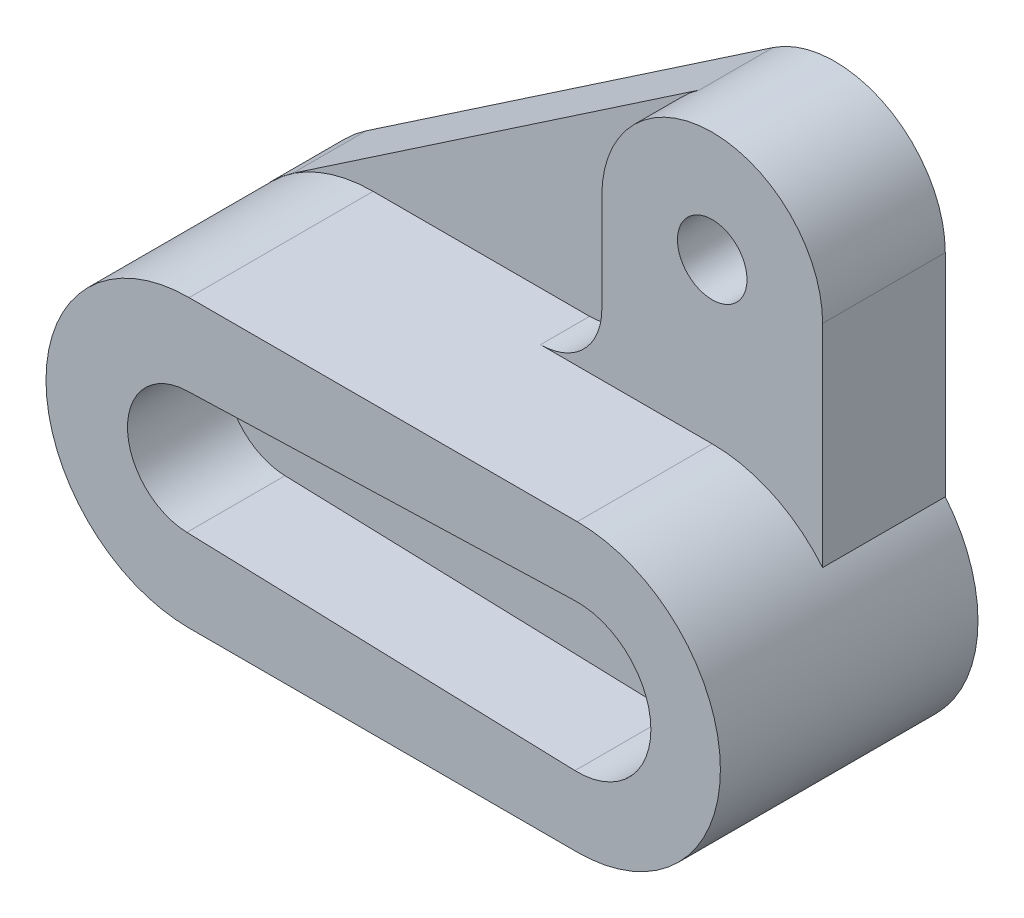
from build123d import *

# Parameters (mm, degrees)
SKETCH1_R           = 8.5
BASE_DEPTH          = 18
BACK_CUT_DEPTH      = 15
BOSS_EXTRUDE2_DEPTH = 45
SKETCH5_R           = 8.5
BOSS_EXTRUDE4_DEPTH = 12
FILLET1_R           = 15
CUT_EXTRUDE2_START  = -24
CUT_EXTRUDE2_DEPTH  = 24


# Read off the part's stored shape, not the designer's step: Boss-Extrude2
with BuildPart() as part:
    # Sketch1 → base (new body)
    with BuildSketch(Plane.XY):
        with BuildLine():
            Line((-95, -35), (0, -35))
            ThreePointArc((0, -35), (31.658229663, -14.925029132), (27, 22.271057451))
            Line((27, 22.271057451), (27, 74))
            ThreePointArc((27, 74), (12.653359163, 97.8514675), (-15.140185324, 96.355643322))
            Line((-15.140185324, 96.355643322), (-114.626166161, 28.97953764))
            ThreePointArc((-114.626166161, 28.97953764), (-128.461050621, -10.26440896), (-95, -35))
        make_face()
        with Locations((0, 74)):
            Circle(SKETCH1_R, mode=Mode.SUBTRACT)
    extrude(amount=BASE_DEPTH)

    # Sketch3 → back cut (cut)
    with BuildSketch(Plane(origin=(0, 0, 0), x_dir=(-1, 0, 0), z_dir=(0, 0, -1))):
        with BuildLine():
            Line((0.568421053, 17.991022692), (95.473684211, 14.99251891))
            ThreePointArc((95.473684211, 14.99251891), (110, 0), (95.473684211, -14.99251891))
            Line((95.473684211, -14.99251891), (0.568421053, -17.991022692))
            ThreePointArc((0.568421053, -17.991022692), (-18, 0), (0.568421053, 17.991022692))
        make_face()
    extrude(amount=-BACK_CUT_DEPTH, mode=Mode.SUBTRACT)

    # Boss-Extrude2 outline → Boss-Extrude2 (add)
    with BuildSketch(Plane.XY.offset(18)):
        with BuildLine():
            Line((-94.999999851, -34.999927116), (0, -35))
            ThreePointArc((0, -35), (35, 0), (0, 35))
            Line((0, 35), (-94.928572613, 35))
            ThreePointArc((-94.928572613, 35), (-129.928554392, 0.035713638), (-94.999999851, -34.999927116))
        make_face()
    extrude(amount=BOSS_EXTRUDE2_DEPTH)

    # Sketch5 → Boss-Extrude4 (add)
    with BuildSketch(Plane.XY.offset(18)):
        with BuildLine():
            Line((-27, 74), (-27, 35))
            Line((-27, 35), (0, 35))
            ThreePointArc((0, 35), (14.925029132, 31.658229663), (27, 22.271057451))
            Line((27, 22.271057451), (27, 74))
            ThreePointArc((27, 74), (0, 101), (-27, 74))
        make_face()
        with Locations((0, 74)):
            Circle(SKETCH5_R, mode=Mode.SUBTRACT)
    extrude(amount=BOSS_EXTRUDE4_DEPTH)

    # Fillet1
    fillet1_edges = [part.edges().sort_by_distance(p)[0] for p in [
        (-27, 35, 24),
    ]]
    fillet(fillet1_edges, radius=FILLET1_R)

    # Sketch6 → Cut-Extrude2 (cut)
    with BuildSketch(Plane.XY.offset(63).offset(CUT_EXTRUDE2_START)):
        with BuildLine():
            Line((-95.473684211, 14.99251891), (-0.568421053, 17.991022692))
            ThreePointArc((-0.568421053, 17.991022692), (18, 0), (-0.568421053, -17.991022692))
            Line((-0.568421053, -17.991022692), (-95.473684211, -14.99251891))
            ThreePointArc((-95.473684211, -14.99251891), (-110, 0), (-95.473684211, 14.99251891))
        make_face()
    extrude(amount=CUT_EXTRUDE2_DEPTH, mode=Mode.SUBTRACT)


solid = part.part
